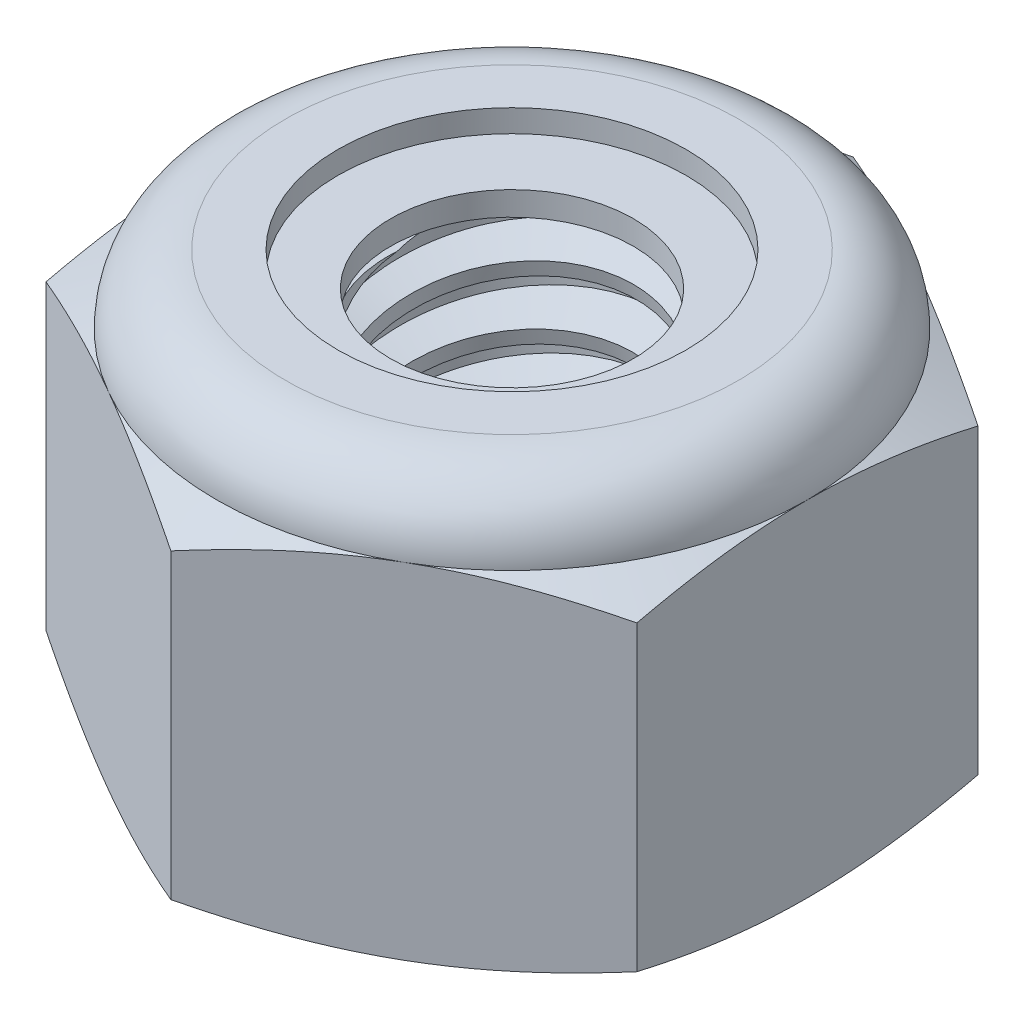
from build123d import *

# Parameters (mm, degrees)
EXTRUDE1_DEPTH       = 2.8
SKETCH2_W            = 1
SKETCH2_H            = 2.8
LPATTERN1_COUNT      = 7
LPATTERN1_PITCH      = 0.4
LPATTERN1_COUNT_DIR2 = 2
LPATTERN1_PITCH_DIR2 = 0.4


with BuildPart() as part:
    # Sketch1 → Extrude1 (new body)
    with BuildSketch(Plane(origin=(0, 0, 0), x_dir=(1, 0, 0), z_dir=(0, 1, 0))):
        Polygon((0, 2.309401077), (-2, 1.154700538), (-2, -1.154700538), (0, -2.309401077), (2, -1.154700538), (2, 1.154700538), align=None)
    extrude(amount=EXTRUDE1_DEPTH)

    # Sketch4 → Cut-Revolve2 (revolve, cut)
    with BuildSketch(Plane(origin=(0, 0, 0), x_dir=(0, 0, -1), z_dir=(1, 0, 0))):
        Polygon((0, 2.8), (1, 2.8), (0.82201838, 2.717005807), (0.82201838, 0.082994193), (1, 0), (0, 0), align=None)
    revolve(axis=Axis((0, 2.8, 0), (0, 1, 0)), mode=Mode.SUBTRACT)


with BuildPart() as body_2:
    # Sketch2 → Revolve1 (revolve)
    with BuildSketch(Plane(origin=(0, 0, 0), x_dir=(0, 0, -1), z_dir=(1, 0, 0))):
        with Locations((0.5, 1.4)):
            Rectangle(SKETCH2_W, SKETCH2_H)
    revolve(axis=Axis((0, -1, 0), (0, 1, 0)))

    # Sketch3 → Cut-Revolve1 (revolve, cut)
    with BuildSketch(Plane(origin=(0, 0, 0), x_dir=(0, 0, -1), z_dir=(1, 0, 0))):
        Polygon((1.009805807, 2.750970966), (1.078446454, 2.40776773), (0.841629993, 2.487879925), (0.82201838, 2.585937993), align=None)
    cut_revolve1 = revolve(axis=Axis((0, 2.8, 0.085891176), (0, -0.9805806756909201, -0.19611613513818418)), mode=Mode.SUBTRACT)

    # LPattern1: Cut-Revolve1 7 × 2
    with Locations(*[Vector(0, -1, 0) * (i * LPATTERN1_PITCH) + Vector(0, 1, 0) * (j * LPATTERN1_PITCH_DIR2) for i in range(LPATTERN1_COUNT) for j in range(LPATTERN1_COUNT_DIR2) if (i, j) != (0, 0)]):
        add(cut_revolve1, mode=Mode.SUBTRACT)


with BuildPart() as part_1:
    add(part.part)

    # Combine1: cut body 2
    add(body_2.part, mode=Mode.SUBTRACT)

    # Sketch5 → Cut-Revolve3 (revolve, cut)
    with BuildSketch(Plane(origin=(0, 0, 0), x_dir=(0, 0, -1), z_dir=(1, 0, 0))):
        with BuildLine():
            Line((0, 0), (2, 0))
            Line((2, 0), (2.309401077, 0.144276092))
            Line((2.309401077, 0.144276092), (2.309401077, 2.189057242))
            Line((2.309401077, 2.189057242), (2, 2.333333333))
            ThreePointArc((2, 2.333333333), (1.863316498, 2.663316498), (1.533333333, 2.8))
            Line((1.533333333, 2.8), (1.533333333, 4.07))
            Line((1.533333333, 4.07), (3.579401077, 4.07))
            Line((3.579401077, 4.07), (3.579401077, -1.27))
            Line((3.579401077, -1.27), (0, -1.27))
            Line((0, -1.27), (0, 0))
        make_face()
    revolve(axis=Axis((0, 0, 0), (0, 1, 0)), mode=Mode.SUBTRACT)

    # Sketch6 → Cut-Revolve4 (revolve, cut)
    with BuildSketch(Plane(origin=(0, 0, 0), x_dir=(0, 0, -1), z_dir=(1, 0, 0))):
        with BuildLine():
            Line((0, 2.333333333), (1.8476, 2.333333333))
            ThreePointArc((1.8476, 2.333333333), (1.755553424, 2.555553424), (1.533333333, 2.6476))
            Line((1.533333333, 2.6476), (1.177675857, 2.6476))
            Line((1.177675857, 2.6476), (1.177675857, 4.07))
            Line((1.177675857, 4.07), (0, 4.07))
            Line((0, 4.07), (0, 2.333333333))
        make_face()
    revolve(axis=Axis((0, 4.07, 0), (0, 1, 0)), mode=Mode.SUBTRACT)


with BuildPart() as body_2_2:
    # Sketch7 → Revolve2 (revolve)
    with BuildSketch(Plane(origin=(0, 0, 0), x_dir=(0, 0, -1), z_dir=(1, 0, 0))):
        with BuildLine():
            Line((0.82201838, 2.409533333), (1.758875564, 2.409533333))
            ThreePointArc((1.758875564, 2.409533333), (1.672140858, 2.526745352), (1.533333333, 2.5714))
            Line((1.533333333, 2.5714), (0.82201838, 2.5714))
            Line((0.82201838, 2.5714), (0.82201838, 2.409533333))
        make_face()
    revolve(axis=Axis((0, 2.409533333, 0), (0, 1, 0)))


solid = Compound([part_1.part, body_2_2.part])
